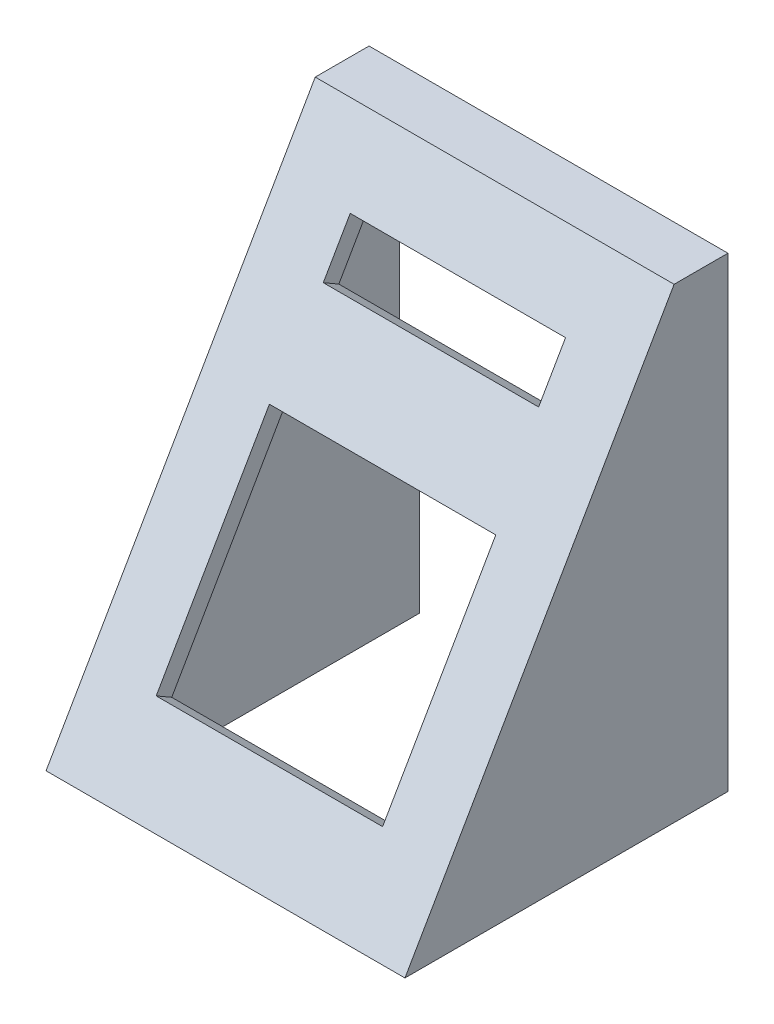
from build123d import *

# Parameters (mm, degrees)
BOSS_EXTRUDE1_DEPTH = 50
SKETCH5_W           = 15
SKETCH5_H           = 129.903810568
BOSS_EXTRUDE2_DEPTH = 50
SKETCH3_W           = 63.082028678
SKETCH3_H           = 63.082028678
SKETCH3_W_2         = 60
SKETCH3_H_2         = 15
CUT_EXTRUDE1_DEPTH  = 131.647426305
CUT_EXTRUDE2_START  = -5
SKETCH4_W           = 75
SKETCH4_H           = 27
CUT_EXTRUDE2_DEPTH  = 126.647426305
CUT_EXTRUDE3_START  = -14
SKETCH6_W           = 83
SKETCH6_H           = 40
CUT_EXTRUDE3_DEPTH  = 100
SKETCH7_R           = 1.5
CUT_EXTRUDE4_DEPTH  = 10


with BuildPart() as part:
    # Sketch1 → Boss-Extrude1 (new, symmetric)
    with BuildSketch(Plane(origin=(0, 0, 0), x_dir=(0, 0, -1), z_dir=(1, 0, 0))):
        Polygon((0, 0), (0, 129.903810568), (-75, 0), align=None)
    extrude(amount=BOSS_EXTRUDE1_DEPTH, both=True)

    # Sketch5 → Boss-Extrude2 (add, symmetric)
    with BuildSketch(Plane(origin=(0, 0, 0), x_dir=(0, 0, -1), z_dir=(1, 0, 0))):
        with Locations((7.5, 64.951905284)):
            Rectangle(SKETCH5_W, SKETCH5_H)
    extrude(amount=BOSS_EXTRUDE2_DEPTH, both=True)

    # Sketch3 → Cut-Extrude1 (cut, through all)
    with BuildSketch(Plane(origin=(0, 32.475952642, 56.25), x_dir=(1, 0, 0), z_dir=(0, 0.49999999999999484, 0.8660254037844416))):
        with Locations((0, 18.5)):
            Rectangle(SKETCH3_W, SKETCH3_H)
        with Locations((0, 84.5)):
            Rectangle(SKETCH3_W_2, SKETCH3_H_2)
    extrude(amount=-CUT_EXTRUDE1_DEPTH, mode=Mode.SUBTRACT)

    # Sketch4 → Cut-Extrude2 (cut, through all)
    with BuildSketch(Plane(origin=(0, 32.475952642, 56.25), x_dir=(1, 0, 0), z_dir=(0, 0.49999999999999484, 0.8660254037844416)).offset(CUT_EXTRUDE2_START)):
        Polygon((-36, 57.5), (36, 57.5), (36, -20.5), (15, -20.5), (15, -32.5), (-15, -32.5), (-15, -20.5), (-36, -20.5), align=None)
        with Locations((0, 84.5)):
            Rectangle(SKETCH4_W, SKETCH4_H)
    extrude(amount=-CUT_EXTRUDE2_DEPTH, mode=Mode.SUBTRACT)

    # Sketch6 → Cut-Extrude3 (cut)
    with BuildSketch(Plane(origin=(0, 32.475952642, 56.25), x_dir=(1, 0, 0), z_dir=(0, 0.49999999999999484, 0.8660254037844416)).offset(CUT_EXTRUDE3_START)):
        with Locations((0, 84.5)):
            Rectangle(SKETCH6_W, SKETCH6_H)
    extrude(amount=-CUT_EXTRUDE3_DEPTH, mode=Mode.SUBTRACT)

    # Sketch7 → Cut-Extrude4 (cut)
    with BuildSketch(Plane(origin=(0, 25.475952642, 44.125644347), x_dir=(-1, 0, 0), z_dir=(0, -0.499999999999995, -0.8660254037844416))):
        with Locations((37.5, 100)):
            Circle(SKETCH7_R)
        with Locations((-37.5, 100)):
            Circle(SKETCH7_R)
        with Locations((37.5, 69)):
            Circle(SKETCH7_R)
        with Locations((-37.5, 69)):
            Circle(SKETCH7_R)
    extrude(amount=-CUT_EXTRUDE4_DEPTH, mode=Mode.SUBTRACT)


solid = part.part
